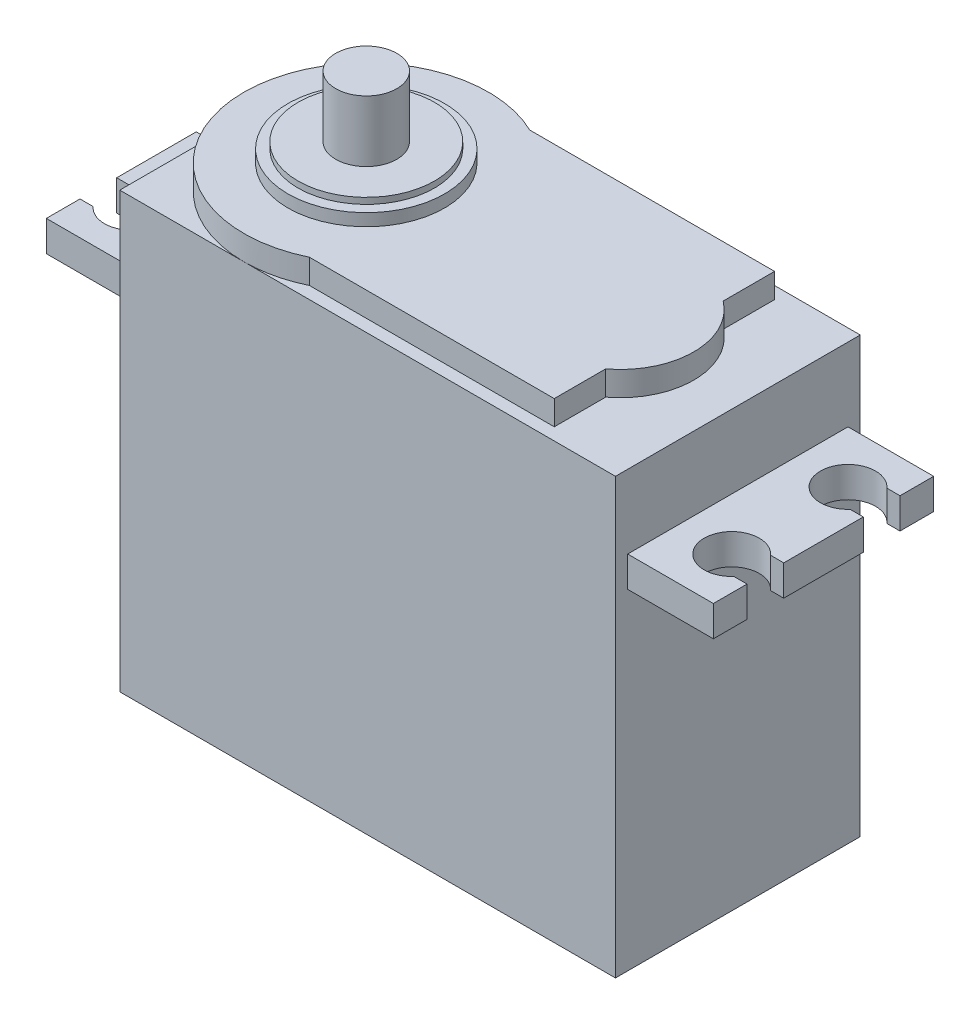
from build123d import *

# Parameters (mm, degrees)
SKETCH1_W            = 40.5
SKETCH1_H            = 20
BOSS_EXTRUDE1_DEPTH  = 35.5
BOSS_EXTRUDE2_DEPTH  = 2
SKETCH3_R            = 6.4
BOSS_EXTRUDE3_DEPTH  = 1
SKETCH4_R            = 5.575
BOSS_EXTRUDE4_DEPTH  = 0.5
BOSS_EXTRUDE5_DEPTH  = 2.5
MIRROR2_COPY_1_DEPTH = 2.5
SKETCH6_R            = 2.5
BOSS_EXTRUDE6_DEPTH  = 5


with BuildPart() as part:
    # Sketch1 → Boss-Extrude1 (new body)
    with BuildSketch(Plane(origin=(0, 0, 0), x_dir=(1, 0, 0), z_dir=(0, 1, 0))):
        Rectangle(SKETCH1_W, SKETCH1_H)
    extrude(amount=BOSS_EXTRUDE1_DEPTH)

    # Sketch2 → Boss-Extrude2 (add)
    with BuildSketch(Plane(origin=(0, 35.5, 0), x_dir=(1, 0, 0), z_dir=(0, 1, 0))):
        with BuildLine():
            Line((-5.75, -9), (14.25, -9))
            Line((14.25, -9), (14.25, -4.8))
            ThreePointArc((14.25, -4.8), (16.65, 0), (14.25, 4.8))
            Line((14.25, 4.8), (14.25, 9))
            Line((14.25, 9), (-5.75, 9))
            ThreePointArc((-5.75, 9), (-20.108898944, 0), (-5.75, -9))
        make_face()
    extrude(amount=BOSS_EXTRUDE2_DEPTH)

    # Sketch3 → Boss-Extrude3 (add)
    with BuildSketch(Plane(origin=(0, 37.5, 0), x_dir=(1, 0, 0), z_dir=(0, 1, 0))):
        with Locations((-10.108898944, 0)):
            Circle(SKETCH3_R)
    extrude(amount=BOSS_EXTRUDE3_DEPTH)

    # Sketch4 → Boss-Extrude4 (add)
    with BuildSketch(Plane(origin=(0, 38.5, 0), x_dir=(1, 0, 0), z_dir=(0, 1, 0))):
        with Locations((-10.108898944, 0)):
            Circle(SKETCH4_R)
    extrude(amount=BOSS_EXTRUDE4_DEPTH)

    # Sketch5 → Boss-Extrude5 (add)
    with BuildSketch(Plane(origin=(0, 29.5, 0), x_dir=(1, 0, 0), z_dir=(0, 1, 0))):
        with BuildLine():
            Line((20.25, 9), (27.25, 9))
            Line((27.25, 9), (27.25, 6.25))
            Line((27.25, 6.25), (26.177050983, 6.25))
            ThreePointArc((26.177050983, 6.25), (22.25, 4.75), (26.177050983, 3.25))
            Line((26.177050983, 3.25), (27.25, 3.25))
            Line((27.25, 3.25), (27.25, 0))
            Line((27.25, 0), (20.25, 0))
            Line((20.25, 0), (20.25, 9))
        make_face()
    boss_extrude5 = extrude(amount=-BOSS_EXTRUDE5_DEPTH)

    # Mirror1: Boss-Extrude5 across plane
    add(boss_extrude5.mirror(Plane(origin=(0, 0, 0), x_dir=(0, 0, 1), z_dir=(1, 0, 0))))

    # Mirror2: Boss-Extrude5 across plane
    add(boss_extrude5.mirror(Plane.XY))

    # Mirror2 copy 1 sketch → Mirror2 copy 1 (add)
    with BuildSketch(Plane(origin=(0, 29.5, 0), x_dir=(-1, 0, 0), z_dir=(0, 1, 0))):
        with BuildLine():
            Line((20.25, 9), (27.25, 9))
            Line((27.25, 9), (27.25, 6.25))
            Line((27.25, 6.25), (26.177050983, 6.25))
            ThreePointArc((26.177050983, 6.25), (22.25, 4.75), (26.177050983, 3.25))
            Line((26.177050983, 3.25), (27.25, 3.25))
            Line((27.25, 3.25), (27.25, 0))
            Line((27.25, 0), (20.25, 0))
            Line((20.25, 0), (20.25, 9))
        make_face()
    extrude(amount=-MIRROR2_COPY_1_DEPTH)

    # Sketch6 → Boss-Extrude6 (add)
    with BuildSketch(Plane(origin=(0, 39, 0), x_dir=(1, 0, 0), z_dir=(0, 1, 0))):
        with Locations((-10.108898944, 0)):
            Circle(SKETCH6_R)
    extrude(amount=BOSS_EXTRUDE6_DEPTH)


solid = part.part
